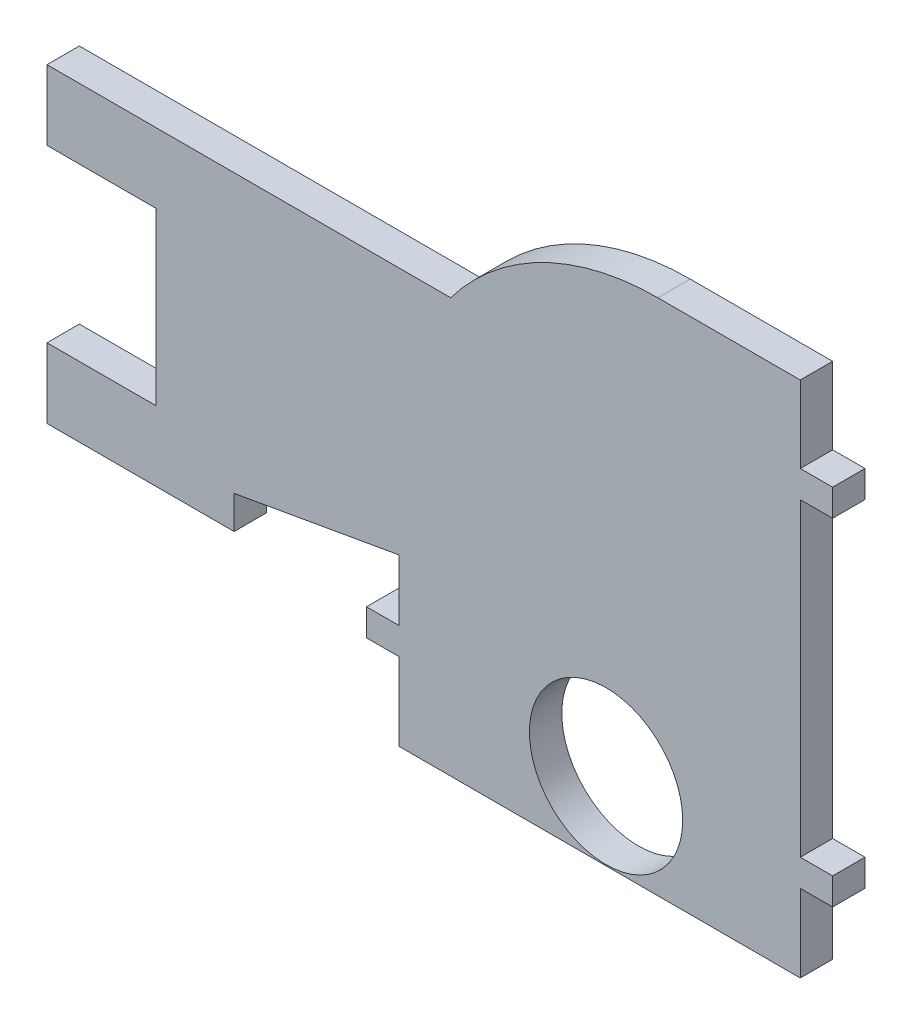
from build123d import *

# Parameters (mm, degrees)
SKETCH1_R           = 3.7592
BOSS_EXTRUDE1_DEPTH = 1.5875


with BuildPart() as part:
    # Sketch1 → Boss-Extrude1 (new body)
    with BuildSketch(Plane.XY):
        with BuildLine():
            Line((-18.241771939, 2.890724209), (-10.16, 4.318))
            Line((-10.16, 4.318), (-10.16, 1.3208))
            Line((-10.16, 1.3208), (-11.7475, 1.3208))
            Line((-11.7475, 1.3208), (-11.7475, 0))
            Line((-11.7475, 0), (-10.16, 0))
            Line((-10.16, 0), (-10.16, -3.81))
            Line((-10.16, -3.81), (9.525, -3.81))
            Line((9.525, -3.81), (9.525, 0))
            Line((9.525, 0), (11.1125, 0))
            Line((11.1125, 0), (11.1125, 1.3208))
            Line((11.1125, 1.3208), (9.525, 1.3208))
            Line((9.525, 1.3208), (9.525, 16.51))
            Line((9.525, 16.51), (11.1125, 16.51))
            Line((11.1125, 16.51), (11.1125, 17.8308))
            Line((11.1125, 17.8308), (9.525, 17.8308))
            Line((9.525, 17.8308), (9.525, 21.59))
            Line((9.525, 21.59), (2.54, 21.59))
            ThreePointArc((2.54, 21.59), (-3.139612663, 20.249225326), (-7.62, 16.51))
            Line((-7.62, 16.51), (-27.418921519, 16.51))
            Line((-27.418921519, 16.51), (-27.418921519, 13.081))
            Line((-27.418921519, 13.081), (-22.084921519, 13.081))
            Line((-22.084921519, 13.081), (-22.084921519, 4.699))
            Line((-22.084921519, 4.699), (-27.418921519, 4.699))
            Line((-27.418921519, 4.699), (-27.418921519, 1.27))
            Line((-27.418921519, 1.27), (-18.241771939, 1.27))
            Line((-18.241771939, 1.27), (-18.241771939, 2.890724209))
        make_face()
        Circle(SKETCH1_R, mode=Mode.SUBTRACT)
    extrude(amount=BOSS_EXTRUDE1_DEPTH)


solid = part.part
